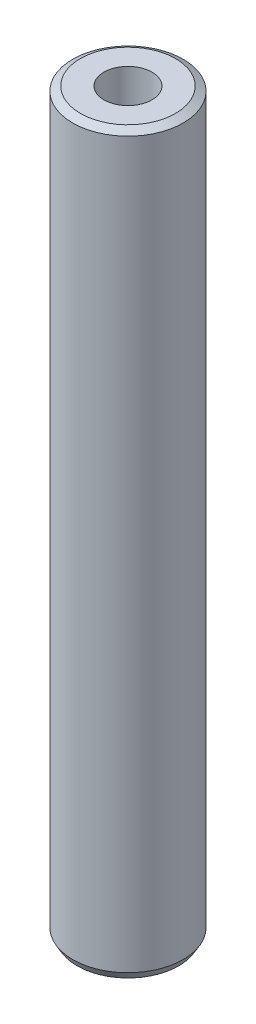
from build123d import *
from OCP.BRepFilletAPI import BRepFilletAPI_MakeChamfer

# Parameters (mm, degrees)
SKETCH1_R           = 45
BOSS_EXTRUDE1_DEPTH = 600
SKETCH2_R           = 19.588031256
CUT_EXTRUDE1_DEPTH  = 604.365560834
CHAMFER1_SIZE       = 3.615342178
CHAMFER1_SIZE2      = 6.26195634


with BuildPart() as part:
    # Sketch1 → Boss-Extrude1 (new body)
    with BuildSketch(Plane(origin=(0, 0, 0), x_dir=(1, 0, 0), z_dir=(0, 1, 0))):
        Circle(SKETCH1_R)
    extrude(amount=BOSS_EXTRUDE1_DEPTH)

    # Sketch2 → Cut-Extrude1 (cut, through all)
    with BuildSketch(Plane(origin=(0, 0, 0), x_dir=(1, 0, 0), z_dir=(0, 1, 0))):
        Circle(SKETCH2_R)
    extrude(amount=CUT_EXTRUDE1_DEPTH, mode=Mode.SUBTRACT)

    # Chamfer1: one chamfer whose edges measure the first distance from different faces: ONE call of the kernel's chamfer builder (chamfer() names one face for all edges)
    chamfer1_edges_1 = [part.edges().sort_by_distance(p)[0] for p in [
        (-45, 600, 0),
    ]]
    chamfer1_side_1 = [part.faces().sort_by_distance(p)[0] for p in [
        (-45, 300, 0),
    ]]
    chamfer1_edges_2 = [part.edges().sort_by_distance(p)[0] for p in [
        (-45, 0, 0),
    ]]
    chamfer1_side_2 = [part.faces().sort_by_distance(p)[0] for p in [
        (-43.727207794, 0, 0),
    ]]
    chamfer1 = BRepFilletAPI_MakeChamfer(part.part.solid().wrapped)
    for e in chamfer1_edges_1:
        chamfer1.Add(CHAMFER1_SIZE, CHAMFER1_SIZE2, e.wrapped, chamfer1_side_1[0].wrapped)  # the first distance lies on this face
    for e in chamfer1_edges_2:
        chamfer1.Add(CHAMFER1_SIZE, CHAMFER1_SIZE2, e.wrapped, chamfer1_side_2[0].wrapped)  # the first distance lies on this face
    add(Compound.cast(chamfer1.Shape()), mode=Mode.REPLACE)


solid = part.part
